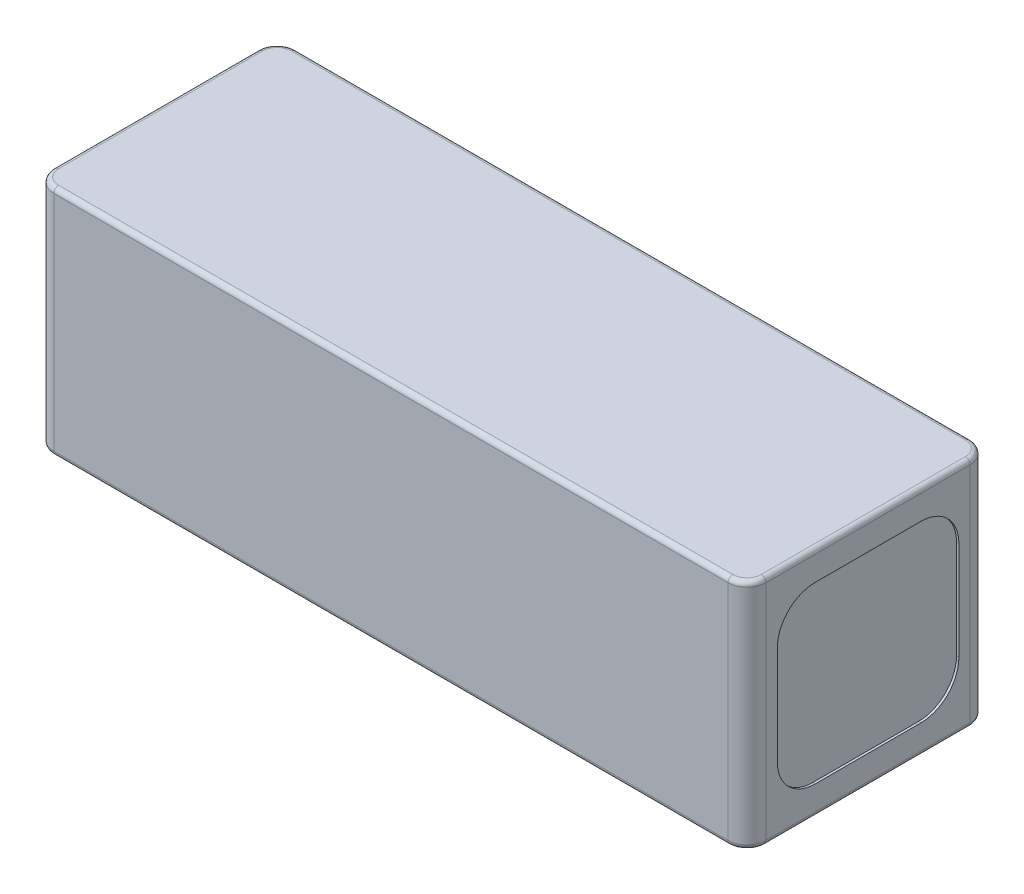
from build123d import *

# Parameters (mm, degrees)
SKETCH1_W           = 150
SKETCH1_H           = 49
BOSS_EXTRUDE1_DEPTH = 51
CUT_EXTRUDE1_DEPTH  = 0.5
CUT_EXTRUDE2_START  = -0.5
CUT_EXTRUDE2_DEPTH  = 0.5
FILLET1_R           = 4
FILLET2_R           = 1


with BuildPart() as part:
    # Sketch1 → Boss-Extrude1 (new body)
    with BuildSketch(Plane(origin=(0, 0, -15), x_dir=(-1, 0, 0), z_dir=(0, 0, -1))):
        with Locations((6, 2.5)):
            Rectangle(SKETCH1_W, SKETCH1_H)
    extrude(amount=-BOSS_EXTRUDE1_DEPTH)

    # Sketch2 → Cut-Extrude1 (cut)
    with BuildSketch(Plane(origin=(69, 0, 0), x_dir=(0, 0, -1), z_dir=(1, 0, 0))):
        with BuildLine():
            Line((-29.625, 12.875), (-29.625, -7.875))
            ThreePointArc((-29.625, -7.875), (-27.281854249, -13.531854249), (-21.625, -15.875))
            Line((-21.625, -15.875), (0.625, -15.875))
            ThreePointArc((0.625, -15.875), (6.281854249, -13.531854249), (8.625, -7.875))
            Line((8.625, -7.875), (8.625, 12.875))
            ThreePointArc((8.625, 12.875), (6.281854249, 18.531854249), (0.625, 20.875))
            Line((0.625, 20.875), (-21.625, 20.875))
            ThreePointArc((-21.625, 20.875), (-27.281854249, 18.531854249), (-29.625, 12.875))
        make_face()
    extrude(amount=-CUT_EXTRUDE1_DEPTH, mode=Mode.SUBTRACT)

    # Sketch3 → Cut-Extrude2 (cut)
    with BuildSketch(Plane.ZY.offset(81).offset(CUT_EXTRUDE2_START)):
        with BuildLine():
            Line((21.625, 20.875), (-0.625, 20.875))
            ThreePointArc((-0.625, 20.875), (-6.281854249, 18.531854249), (-8.625, 12.875))
            Line((-8.625, 12.875), (-8.625, -7.875))
            ThreePointArc((-8.625, -7.875), (-6.281854249, -13.531854249), (-0.625, -15.875))
            Line((-0.625, -15.875), (21.625, -15.875))
            ThreePointArc((21.625, -15.875), (27.281854249, -13.531854249), (29.625, -7.875))
            Line((29.625, -7.875), (29.625, 12.875))
            ThreePointArc((29.625, 12.875), (27.281854249, 18.531854249), (21.625, 20.875))
        make_face()
    extrude(amount=CUT_EXTRUDE2_DEPTH, mode=Mode.SUBTRACT)

    # Fillet1
    fillet1_edges = [part.edges().sort_by_distance(p)[0] for p in [
        (-81, 2.5, -15),
        (-81, 2.5, 36),
        (69, 2.5, -15),
        (69, 2.5, 36),
    ]]
    fillet(fillet1_edges, radius=FILLET1_R)

    # Fillet2
    fillet2_edges = [part.edges().sort_by_distance(p)[0] for p in [
        (67.828427125, 27, -13.828427125),
        (69, 27, 10.5),
        (-6, 27, -15),
        (67.828427125, 27, 34.828427125),
        (-79.828427125, 27, -13.828427125),
        (-6, 27, 36),
        (-81, 27, 10.5),
        (-79.828427125, 27, 34.828427125),
        (-81, -22, 10.5),
        (-79.828427125, -22, -13.828427125),
        (-79.828427125, -22, 34.828427125),
        (-6, -22, -15),
        (-6, -22, 36),
        (67.828427125, -22, -13.828427125),
        (67.828427125, -22, 34.828427125),
        (69, -22, 10.5),
    ]]
    fillet(fillet2_edges, radius=FILLET2_R)


solid = part.part
